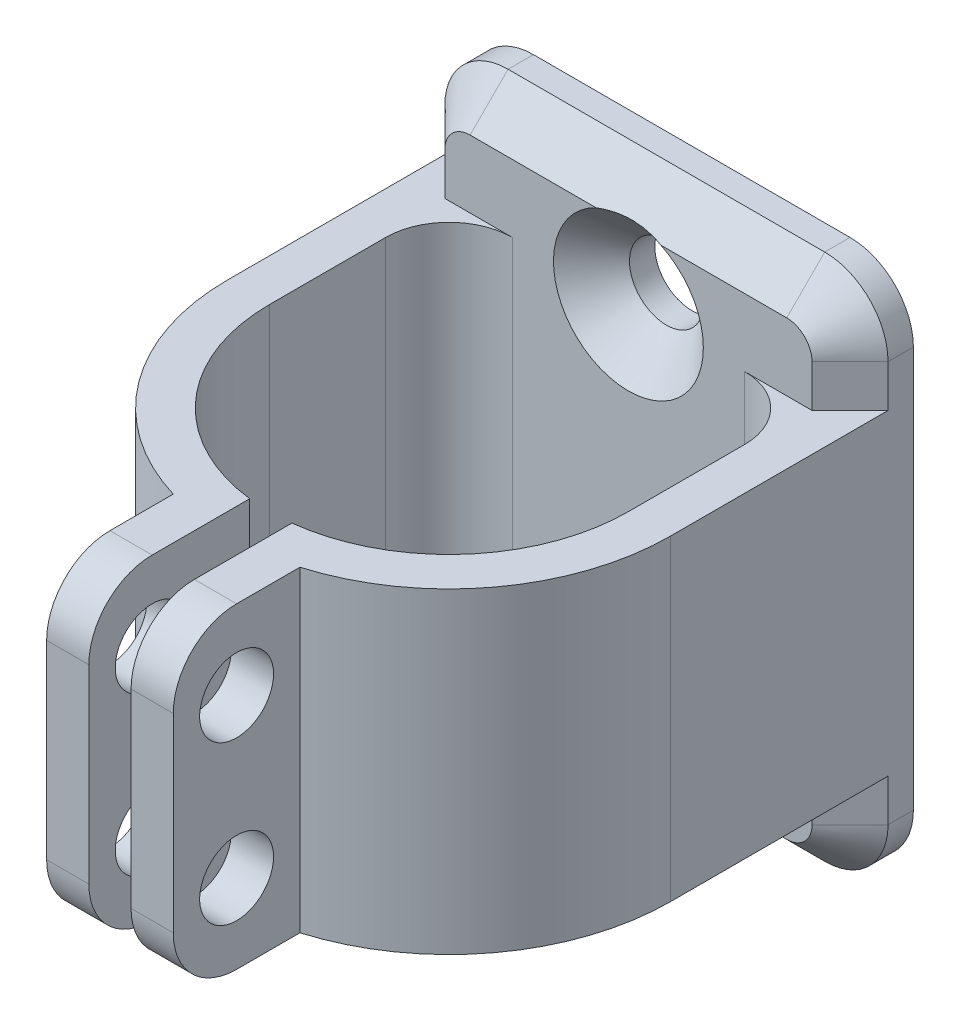
from build123d import *

# Parameters (mm, degrees)
SKETCH1_W               = 21
SKETCH1_H               = 25
SKETCH1_R               = 1.75
BOSS_EXTRUDE1_DEPTH     = 3
BOSS_EXTRUDE2_DEPTH     = 7.5
CUT_EXTRUDE1_DEPTH      = 34.138809672
CUT_EXTRUDE1_DEPTH_BACK = 34.138809672
SKETCH4_R               = 1.75
FILLET1_R               = 3
FILLET3_R               = 3
CHAMFER1_SIZE           = 1.8


with BuildPart() as part:
    # Sketch1 → Boss-Extrude1 (new body)
    with BuildSketch(Plane.XY):
        Rectangle(SKETCH1_W, SKETCH1_H)
        with Locations((0, 7.5)):
            Circle(SKETCH1_R, mode=Mode.SUBTRACT)
        with Locations((0, -7.5)):
            Circle(SKETCH1_R, mode=Mode.SUBTRACT)
    extrude(amount=BOSS_EXTRUDE1_DEPTH)

    # Sketch3 → Boss-Extrude2 (add, symmetric)
    with BuildSketch(Plane(origin=(0, 0, 0), x_dir=(1, 0, 0), z_dir=(0, 1, 0))):
        with BuildLine():
            Line((-8.5, -3), (-8.5, -11.5))
            ThreePointArc((-8.5, -11.5), (-6.354132514, -17.145794895), (-1, -19.940971508))
            Line((-1, -19.940971508), (-1, -27.562305899))
            Line((-1, -27.562305899), (-3, -27.562305899))
            Line((-3, -27.562305899), (-3, -21.562305899))
            ThreePointArc((-3, -21.562305899), (-8.41872912, -17.774950199), (-10.5, -11.5))
            Line((-10.5, -11.5), (-10.5, -3))
            Line((-10.5, -3), (-8.5, -3))
        make_face()
        with BuildLine():
            Line((10.5, -11.5), (10.5, -3))
            Line((10.5, -3), (8.5, -3))
            Line((8.5, -3), (8.5, -11.5))
            ThreePointArc((8.5, -11.5), (6.354132514, -17.145794895), (1, -19.940971508))
            Line((1, -19.940971508), (1, -27.562305899))
            Line((1, -27.562305899), (3, -27.562305899))
            Line((3, -27.562305899), (3, -21.562305899))
            ThreePointArc((3, -21.562305899), (8.41872912, -17.774950199), (10.5, -11.5))
        make_face()
    extrude(amount=BOSS_EXTRUDE2_DEPTH, both=True)

    # Sketch4 → Cut-Extrude1 (cut, two sides: drawn at the far end of the back side and taken through both)
    with BuildSketch(Plane(origin=(3, 0, 0), x_dir=(0, 0, -1), z_dir=(1, 0, 0)).offset(-CUT_EXTRUDE1_DEPTH_BACK)):
        with Locations((-24.562305899, 3.75)):
            Circle(SKETCH4_R)
        with Locations((-24.562305899, -3.75)):
            Circle(SKETCH4_R)
    extrude(amount=CUT_EXTRUDE1_DEPTH + CUT_EXTRUDE1_DEPTH_BACK, mode=Mode.SUBTRACT)

    # Fillet1
    fillet1_edges = [part.edges().sort_by_distance(p)[0] for p in [
        (-2, -7.5, 27.562305899),
        (-2, 7.5, 27.562305899),
        (2, -7.5, 27.562305899),
        (2, 7.5, 27.562305899),
        (10.5, -12.5, 1.5),
        (-10.5, -12.5, 1.5),
        (-10.5, 12.5, 1.5),
        (10.5, 12.5, 1.5),
    ]]
    fillet(fillet1_edges, radius=FILLET1_R)

    # Fillet3
    fillet3_edges = [part.edges().sort_by_distance(p)[0] for p in [
        (-8.5, 0, 3),
        (8.5, 0, 3),
    ]]
    fillet(fillet3_edges, radius=FILLET3_R)

    # Chamfer1
    # the kernel refuses this chamfer: 1.8 mm, written as the material it takes off along each edge
    with BuildSketch(Plane(origin=(-7.5, 12.5, 3), x_dir=(0, -0.9996219169112966, 0.027495876610586382), z_dir=(1, 0, 0)), Plane(origin=(7.5, -12.5, 3), x_dir=(0, 0.9996219169112966, 0.027495876610586382), z_dir=(-1, 0, 0))) as chamfer1_piece_1:
        Polygon((CHAMFER1_SIZE * 0.999621916911, CHAMFER1_SIZE * 0.0274958766106), (-CHAMFER1_SIZE * 0.0274958766106, CHAMFER1_SIZE * 0.999621916911), (0, 0), align=None)
    extrude(amount=15, mode=Mode.SUBTRACT)
    with BuildSketch(Plane(origin=(10.5, -7.5, 3), x_dir=(-0.9996219169112966, 0, 0.027495876610586382), z_dir=(0, -1, 0)), Plane(origin=(-10.5, -9.5, 3), x_dir=(0.9996219169112966, 0, 0.027495876610586382), z_dir=(0, 1, 0)), Plane(origin=(10.5, 9.5, 3), x_dir=(-0.9996219169112966, 0, 0.027495876610586382), z_dir=(0, -1, 0)), Plane(origin=(-10.5, 7.5, 3), x_dir=(0.9996219169112966, 0, 0.027495876610586382), z_dir=(0, 1, 0))) as chamfer1_piece_2:
        Polygon((CHAMFER1_SIZE * 0.999621916911, CHAMFER1_SIZE * 0.0274958766106), (-CHAMFER1_SIZE * 0.0274958766106, CHAMFER1_SIZE * 0.999621916911), (0, 0), align=None)
    extrude(amount=2, mode=Mode.SUBTRACT)
    with BuildSketch(Plane(origin=(7.5, 9.5, 3), x_dir=(0, 1, 0), z_dir=(-1, 0, 0))) as chamfer1_piece_3:
        Polygon((3 - CHAMFER1_SIZE, 0), (3, CHAMFER1_SIZE), (3, 0), align=None)
    revolve(axis=Axis((7.5, 9.5, 3), (0, 0, -1)), revolution_arc=90, mode=Mode.SUBTRACT)
    with BuildSketch(Plane(origin=(7.5, -9.5, 3), x_dir=(1, 0, 0), z_dir=(0, 1, 0))) as chamfer1_piece_4:
        Polygon((3 - CHAMFER1_SIZE, 0), (3, CHAMFER1_SIZE), (3, 0), align=None)
    revolve(axis=Axis((7.5, -9.5, 3), (0, 0, -1)), revolution_arc=90, mode=Mode.SUBTRACT)
    with BuildSketch(Plane(origin=(-7.5, -9.5, 3), x_dir=(-1, 0, 0), z_dir=(0, 1, 0))) as chamfer1_piece_5:
        Polygon((3 - CHAMFER1_SIZE, 0), (3, -CHAMFER1_SIZE), (3, 0), align=None)
    revolve(axis=Axis((-7.5, -9.5, 3), (0, 0, 1)), revolution_arc=90, mode=Mode.SUBTRACT)
    with BuildSketch(Plane(origin=(-7.5, 9.5, 3), x_dir=(0, 1, 0), z_dir=(1, 0, 0))) as chamfer1_piece_6:
        Polygon((3 - CHAMFER1_SIZE, 0), (3, -CHAMFER1_SIZE), (3, 0), align=None)
    revolve(axis=Axis((-7.5, 9.5, 3), (0, 0, 1)), revolution_arc=90, mode=Mode.SUBTRACT)
    with BuildSketch(Plane(origin=(0, 7.5, 3), x_dir=(1, 0, 0), z_dir=(0, -1, 0))) as chamfer1_piece_7:
        Polygon((1.75 + CHAMFER1_SIZE, 0), (1.75, -CHAMFER1_SIZE), (1.75, 0), align=None)
    revolve(axis=Axis((0, 7.5, 3), (0, 0, 1)), mode=Mode.SUBTRACT)
    with BuildSketch(Plane(origin=(0, -7.5, 3), x_dir=(1, 0, 0), z_dir=(0, -1, 0))) as chamfer1_piece_8:
        Polygon((1.75 + CHAMFER1_SIZE, 0), (1.75, -CHAMFER1_SIZE), (1.75, 0), align=None)
    revolve(axis=Axis((0, -7.5, 3), (0, 0, 1)), mode=Mode.SUBTRACT)


solid = part.part
